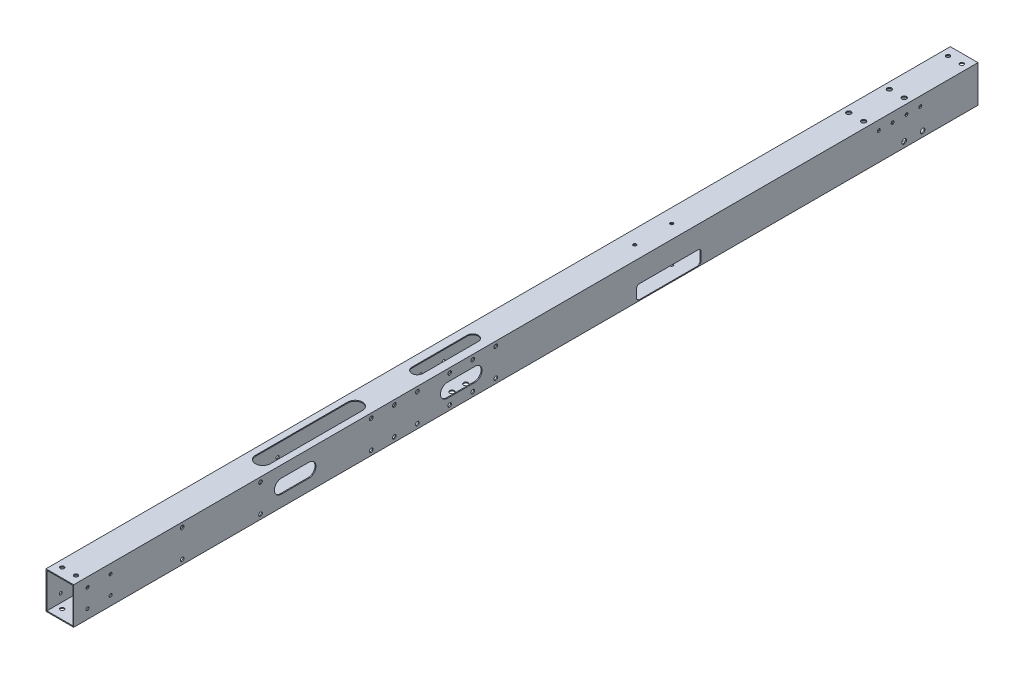
from build123d import *

# Parameters (mm, degrees)
SKETCH_1_W             = 30
SKETCH_1_H             = 40
SKETCH_1_W_2           = 28
SKETCH_1_H_2           = 38
EXTRUDE_1_DEPTH        = 940
SKETCH_5_R             = 2.5
CUT_EXTRUDE_3_DEPTH    = 941.97024395
CUT_EXTRUDE_4_DEPTH    = 1
SKETCH_7_R             = 1.75
CUT_EXTRUDE_5_DEPTH    = 1
SKETCH_17_W            = 30
SKETCH_17_H            = 40
SKETCH_17_W_2          = 28
SKETCH_17_H_2          = 38
EXTRUDE_2_DEPTH        = 20
SKETCH_18_W            = 30
SKETCH_18_H            = 40
SKETCH_18_W_2          = 28
SKETCH_18_H_2          = 38
EXTRUDE_3_DEPTH        = 20
SKETCH_19_R            = 2.1
CUT_EXTRUDE_16_DEPTH   = 961.950050731
SKETCH_20_R            = 1.6
CUT_EXTRUDE_17_DEPTH   = 961.67684473
SKETCH_21_R            = 2.5
SKETCH_21_R_2          = 1.6
CUT_EXTRUDE_18_DEPTH   = 961.67684473
SKETCH_23_R            = 2.5
CUT_EXTRUDE_19_DEPTH   = 961.950050731
SKETCH_24_R            = 4.5
CUT_EXTRUDE_20_DEPTH   = 10
SKETCH_26_R            = 2
CUT_EXTRUDE_22_DEPTH   = 961.67684473
CUT_EXTRUDE_28_DEPTH   = 10
PATTERN_LINEAR_4_COUNT = 2
PATTERN_LINEAR_4_PITCH = 255
PATTERN_LINEAR_8_COUNT = 2
PATTERN_LINEAR_8_PITCH = 205
PATTERN_LINEAR_9_COUNT = 2
PATTERN_LINEAR_9_PITCH = 230
CUT_EXTRUDE_START      = -20
SKETCH_34_R            = 1.75
CUT_EXTRUDE_29_DEPTH   = 20
SKETCH_35_R            = 1.5
CUT_EXTRUDE_30_DEPTH   = 10
CUT_EXTRUDE_31_DEPTH   = 10
SKETCH_37_R            = 1.65
CUT_EXTRUDE_32_DEPTH   = 52
SKETCH_39_R            = 1.75
CUT_EXTRUDE_33_DEPTH   = 10
SKETCH_40_W            = 70
SKETCH_40_H            = 15
CUT_EXTRUDE_34_DEPTH   = 10
EXTRUDE_5_DEPTH        = 1
SKETCH_43_W            = 38.522995696
SKETCH_43_H            = 13.00002022
EXTRUDE_6_DEPTH        = 1
FILLET_1_R             = 3


with BuildPart() as part:
    # 草图1 → 凸台-拉伸1 (new body)
    with BuildSketch(Plane.XY):
        Rectangle(SKETCH_1_W, SKETCH_1_H)
        Rectangle(SKETCH_1_W_2, SKETCH_1_H_2, mode=Mode.SUBTRACT)
    extrude(amount=EXTRUDE_1_DEPTH)

    # 草图5 → 切除-拉伸3 (cut, through all)
    with BuildSketch(Plane.XZ.offset(20)):
        with Locations((-8, 53)):
            Circle(SKETCH_5_R)
        with Locations((8, 53)):
            Circle(SKETCH_5_R)
        with Locations((-8, 97)):
            Circle(SKETCH_5_R)
        with Locations((8, 97)):
            Circle(SKETCH_5_R)
    extrude(amount=-CUT_EXTRUDE_3_DEPTH, mode=Mode.SUBTRACT)

    # 草图6 → 切除-拉伸4 (cut)
    with BuildSketch(Plane(origin=(15, 0, 0), x_dir=(0, 0, -1), z_dir=(1, 0, 0))):
        with BuildLine():
            Line((-345, -7.5), (-375, -7.5))
            ThreePointArc((-375, -7.5), (-382.5, 0), (-375, 7.5))
            Line((-375, 7.5), (-345, 7.5))
            ThreePointArc((-345, 7.5), (-337.5, 0), (-345, -7.5))
        make_face()
        with BuildLine():
            Line((-525, -7.5), (-555, -7.5))
            ThreePointArc((-555, -7.5), (-562.5, 0), (-555, 7.5))
            Line((-555, 7.5), (-525, 7.5))
            ThreePointArc((-525, 7.5), (-517.5, 0), (-525, -7.5))
        make_face()
        with BuildLine():
            Line((-705, -7.5), (-735, -7.5))
            ThreePointArc((-735, -7.5), (-742.5, 0), (-735, 7.5))
            Line((-735, 7.5), (-705, 7.5))
            ThreePointArc((-705, 7.5), (-697.5, 0), (-705, -7.5))
        make_face()
    extrude(amount=-CUT_EXTRUDE_4_DEPTH, mode=Mode.SUBTRACT)

    # 草图7 → 切除-拉伸5 (cut)
    with BuildSketch(Plane.ZY.offset(15)):
        with Locations((350, 0)):
            Circle(SKETCH_7_R)
        with Locations((375, 0)):
            Circle(SKETCH_7_R)
        with Locations((530, 0)):
            Circle(SKETCH_7_R)
        with Locations((555, 0)):
            Circle(SKETCH_7_R)
        with Locations((710, 0)):
            Circle(SKETCH_7_R)
        with Locations((735, 0)):
            Circle(SKETCH_7_R)
    extrude(amount=-CUT_EXTRUDE_5_DEPTH, mode=Mode.SUBTRACT)

    # 草图17 → 凸台-拉伸2 (add)
    with BuildSketch(Plane.XY.offset(940)):
        Rectangle(SKETCH_17_W, SKETCH_17_H)
        Rectangle(SKETCH_17_W_2, SKETCH_17_H_2, mode=Mode.SUBTRACT)
    extrude(amount=EXTRUDE_2_DEPTH)

    # 草图18 → 凸台-拉伸3 (add)
    with BuildSketch(Plane(origin=(0, 0, 0), x_dir=(-1, 0, 0), z_dir=(0, 0, -1))):
        Rectangle(SKETCH_18_W, SKETCH_18_H)
        Rectangle(SKETCH_18_W_2, SKETCH_18_H_2, mode=Mode.SUBTRACT)
    extrude(amount=EXTRUDE_3_DEPTH)

    # 草图19 → 切除-拉伸16 (cut, through all)
    with BuildSketch(Plane(origin=(0, 20, 0), x_dir=(1, 0, 0), z_dir=(0, 1, 0))):
        with Locations((-7.5, -950)):
            Circle(SKETCH_19_R)
        with Locations((7.5, -950)):
            Circle(SKETCH_19_R)
        with Locations((-7.5, 10)):
            Circle(SKETCH_19_R)
        with Locations((7.5, 10)):
            Circle(SKETCH_19_R)
    extrude(amount=-CUT_EXTRUDE_16_DEPTH, mode=Mode.SUBTRACT)

    # 草图20 → 切除-拉伸17 (cut, through all)
    with BuildSketch(Plane(origin=(15, 0, 0), x_dir=(0, 0, -1), z_dir=(1, 0, 0))):
        with Locations((-945, 10)):
            Circle(SKETCH_20_R)
        with Locations((-920, 10)):
            Circle(SKETCH_20_R)
        with Locations((-920, -10)):
            Circle(SKETCH_20_R)
        with Locations((-945, -10)):
            Circle(SKETCH_20_R)
    extrude(amount=-CUT_EXTRUDE_17_DEPTH, mode=Mode.SUBTRACT)

    # 草图21 → 切除-拉伸18 (cut, through all)
    with BuildSketch(Plane(origin=(15, 0, 0), x_dir=(0, 0, -1), z_dir=(1, 0, 0))):
        with Locations((-40, -14)):
            Circle(SKETCH_21_R)
        with Locations((-60, -14)):
            Circle(SKETCH_21_R)
        with Locations((-42.5, 10)):
            Circle(SKETCH_21_R_2)
        with Locations((-57.5, 10)):
            Circle(SKETCH_21_R_2)
        with Locations((-72.5, 10)):
            Circle(SKETCH_21_R_2)
        with Locations((-87.5, 10)):
            Circle(SKETCH_21_R_2)
    extrude(amount=-CUT_EXTRUDE_18_DEPTH, mode=Mode.SUBTRACT)

    # 草图23 → 切除-拉伸19 (cut, through all)
    with BuildSketch(Plane(origin=(0, 20, 0), x_dir=(1, 0, 0), z_dir=(0, 1, 0))):
        with Locations((0, -520)):
            Circle(SKETCH_23_R)
        with Locations((0, -535)):
            Circle(SKETCH_23_R)
        with Locations((0, -550)):
            Circle(SKETCH_23_R)
        with Locations((0, -565)):
            Circle(SKETCH_23_R)
    extrude(amount=-CUT_EXTRUDE_19_DEPTH, mode=Mode.SUBTRACT)

    # 草图24 → 切除-拉伸20 (cut)
    with BuildSketch(Plane(origin=(0, 20, 0), x_dir=(1, 0, 0), z_dir=(0, 1, 0))):
        with Locations((0, -520)):
            Circle(SKETCH_24_R)
        with Locations((0, -535)):
            Circle(SKETCH_24_R)
        with Locations((0, -550)):
            Circle(SKETCH_24_R)
        with Locations((0, -565)):
            Circle(SKETCH_24_R)
    extrude(amount=-CUT_EXTRUDE_20_DEPTH, mode=Mode.SUBTRACT)

    # 草图26 → 切除-拉伸22 (cut, through all)
    with BuildSketch(Plane(origin=(15, 0, 0), x_dir=(0, 0, -1), z_dir=(1, 0, 0))):
        with Locations((-842.5, 15)):
            Circle(SKETCH_26_R)
        with Locations((-842.5, -15)):
            Circle(SKETCH_26_R)
        with Locations((-757.5, -15)):
            Circle(SKETCH_26_R)
        with Locations((-757.5, 15)):
            Circle(SKETCH_26_R)
    cut_extrude_22 = extrude(amount=-CUT_EXTRUDE_22_DEPTH, mode=Mode.SUBTRACT)

    # 草图33 → 切除-拉伸28 (cut)
    with BuildSketch(Plane(origin=(0, 20, 0), x_dir=(1, 0, 0), z_dir=(0, 1, 0))):
        with BuildLine():
            Line((6, -512.5), (6, -572.5))
            ThreePointArc((6, -572.5), (0, -578.5), (-6, -572.5))
            Line((-6, -572.5), (-6, -512.5))
            ThreePointArc((-6, -512.5), (0, -506.5), (6, -512.5))
        make_face()
    extrude(amount=-CUT_EXTRUDE_28_DEPTH, mode=Mode.SUBTRACT)

    # 阵列(线性)4: 切除-拉伸22 ×2
    with Locations(*[(0, 0, -i * PATTERN_LINEAR_4_PITCH) for i in range(1, PATTERN_LINEAR_4_COUNT)]):
        add(cut_extrude_22, mode=Mode.SUBTRACT)

    # 阵列(线性)8: 切除-拉伸22 ×2
    with Locations(*[(0, 0, -i * PATTERN_LINEAR_8_PITCH) for i in range(1, PATTERN_LINEAR_8_COUNT)]):
        add(cut_extrude_22, mode=Mode.SUBTRACT)

    # 阵列(线性)9: 切除-拉伸22 ×2
    with Locations(*[(0, 0, -i * PATTERN_LINEAR_9_PITCH) for i in range(1, PATTERN_LINEAR_9_COUNT)]):
        add(cut_extrude_22, mode=Mode.SUBTRACT)

    # 草图34 → 切除-拉伸29 (cut)
    with BuildSketch(Plane(origin=(15, 0, 0), x_dir=(0, 0, -1), z_dir=(1, 0, 0)).offset(CUT_EXTRUDE_START)):
        with Locations((-905, 0)):
            Circle(SKETCH_34_R)
        with Locations((-880, 0)):
            Circle(SKETCH_34_R)
    extrude(amount=-CUT_EXTRUDE_29_DEPTH, mode=Mode.SUBTRACT)

    # 草图35 → 切除-拉伸30 (cut)
    with BuildSketch(Plane.XZ.offset(20)):
        with Locations((5, 720)):
            Circle(SKETCH_35_R)
        with Locations((5, 700)):
            Circle(SKETCH_35_R)
        with Locations((5, 680)):
            Circle(SKETCH_35_R)
        with Locations((5, 660)):
            Circle(SKETCH_35_R)
        with Locations((5, 640)):
            Circle(SKETCH_35_R)
        with Locations((5, 740)):
            Circle(SKETCH_35_R)
    extrude(amount=-CUT_EXTRUDE_30_DEPTH, mode=Mode.SUBTRACT)

    # 草图36 → 切除-拉伸31 (cut)
    with BuildSketch(Plane(origin=(0, 20, 0), x_dir=(1, 0, 0), z_dir=(0, 1, 0))):
        with BuildLine():
            Line((8, -640), (8, -740))
            ThreePointArc((8, -740), (0, -748), (-8, -740))
            Line((-8, -740), (-8, -640))
            ThreePointArc((-8, -640), (0, -632), (8, -640))
        make_face()
    extrude(amount=-CUT_EXTRUDE_31_DEPTH, mode=Mode.SUBTRACT)

    # 草图37 → 切除-拉伸32 (cut)
    with BuildSketch(Plane(origin=(0, 20, 0), x_dir=(1, 0, 0), z_dir=(0, 1, 0))):
        with Locations((0, -297)):
            Circle(SKETCH_37_R)
        with Locations((0, -337)):
            Circle(SKETCH_37_R)
    extrude(amount=-CUT_EXTRUDE_32_DEPTH, mode=Mode.SUBTRACT)

    # 草图39 → 切除-拉伸33 (cut)
    with BuildSketch(Plane.XZ.offset(20)):
        with Locations((0, 137)):
            Circle(SKETCH_39_R)
        with Locations((0, 177)):
            Circle(SKETCH_39_R)
    extrude(amount=-CUT_EXTRUDE_33_DEPTH, mode=Mode.SUBTRACT)

    # 草图40 → 切除-拉伸34 (cut)
    with BuildSketch(Plane(origin=(15, 0, 0), x_dir=(0, 0, -1), z_dir=(1, 0, 0))):
        with Locations((-315, -11.5)):
            Rectangle(SKETCH_40_W, SKETCH_40_H)
    extrude(amount=-CUT_EXTRUDE_34_DEPTH, mode=Mode.SUBTRACT)

    # 草图42 → 凸台-拉伸5 (add)
    with BuildSketch(Plane(origin=(15, 0, 0), x_dir=(0, 0, -1), z_dir=(1, 0, 0))):
        Polygon((-350, -8.24794841), (-350, -4), (-334.23295051, -4), (-334.23295051, 12.222841732), (-383.610977641, 12.222841732), (-383.610977641, -8.24794841), align=None)
    extrude(amount=-EXTRUDE_5_DEPTH)

    # 草图43 → 凸台-拉伸6 (add)
    with BuildSketch(Plane.ZY.offset(15)):
        with Locations((362.400416305, 1.435266839)):
            Rectangle(SKETCH_43_W, SKETCH_43_H)
    extrude(amount=-EXTRUDE_6_DEPTH)

    # 圆角1
    fillet_1_edges = [part.edges().sort_by_distance(p)[0] for p in [
        (14.5, -19, 280),
        (14.5, -4, 280),
        (14.5, -19, 350),
        (14.5, -4, 350),
    ]]
    fillet(fillet_1_edges, radius=FILLET_1_R)


solid = part.part
